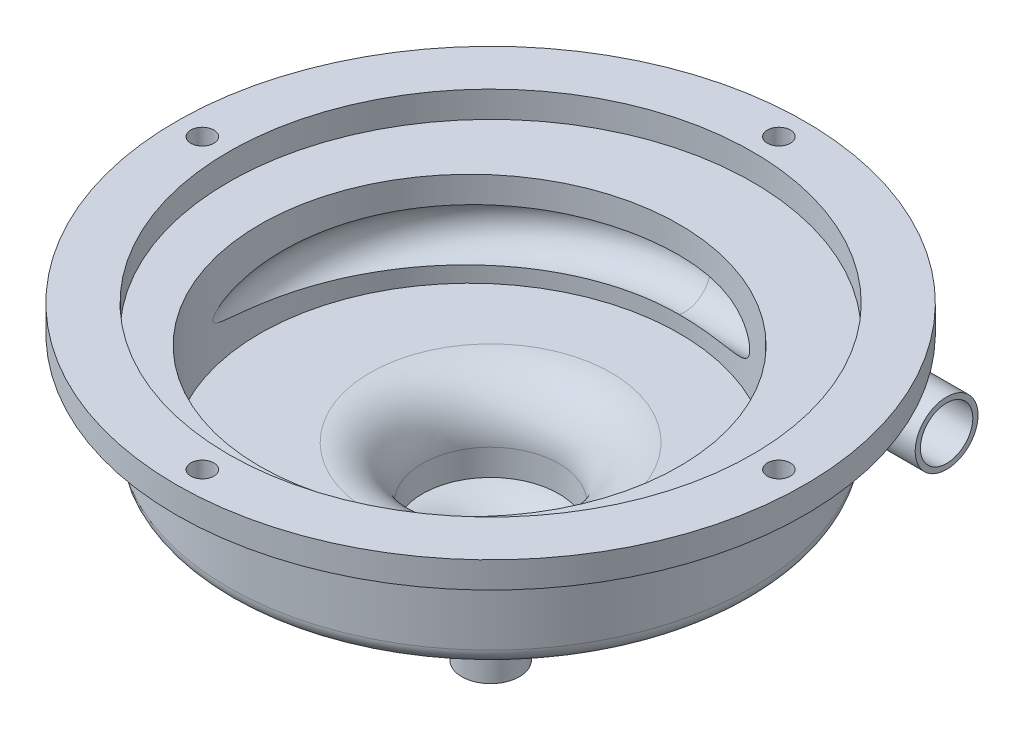
from build123d import *

# Parameters (mm, degrees)
SKETCH1_R                = 50
SKETCH1_R_2              = 40
BOSS_EXTRUDE1_DEPTH      = 20
BOSS_EXTRUDE2_DEPTH      = 2
BOSS_EXTRUDE2_DEPTH_BACK = 4
SKETCH2_R                = 40
SKETCH3_R                = 60
SKETCH3_R_2              = 50
SKETCH3_R_3              = 2.2
SKETCH3_R_4              = 2.2000000000012125
SKETCH3_R_5              = 2.200000000003338
SKETCH3_R_6              = 2.200000000002496
BOSS_EXTRUDE3_DEPTH      = 5
SKETCH4_R                = 5.999999999999995
SKETCH4_R_2              = 4.750000000000005
SKETCH7_R                = 4.9999999999999964
SKETCH9_R                = 15
BOSS_EXTRUDE5_DEPTH      = 15
SKETCH10_R               = 5.5
BOSS_EXTRUDE6_DEPTH      = 15
SKETCH11_R               = 4.5
CUT_EXTRUDE1_DEPTH       = 104.34892355511015
SKETCH12_R               = 13
CUT_EXTRUDE2_DEPTH       = 15
FILLET1_R                = 10
FILLET2_R                = 3


with BuildPart() as part:
    # Sketch1 → Boss-Extrude1 (new body)
    with BuildSketch(Plane(origin=(0, 0, 0), x_dir=(1, 0, 0), z_dir=(0, 1, 0))):
        with Locations(Location((0, 0, 0), (0, 0, 270))):
            Circle(SKETCH1_R)
        with Locations(Location((0, -4, 0), (0, 0, 270))):
            Circle(SKETCH1_R_2, mode=Mode.SUBTRACT)
    extrude(amount=BOSS_EXTRUDE1_DEPTH)

    # Sketch2 → Boss-Extrude2 (add, two sides: drawn at the far end of the back side and taken through both)
    with BuildSketch(Plane(origin=(0, 0, 0), x_dir=(1, 0, 0), z_dir=(0, 1, 0)).offset(-BOSS_EXTRUDE2_DEPTH_BACK)):
        with Locations(Location((0, -4, 0), (0, 0, 270))):
            Circle(SKETCH2_R)
    extrude(amount=BOSS_EXTRUDE2_DEPTH + BOSS_EXTRUDE2_DEPTH_BACK)

    # Sweep1: sweep along a path in Sketch5
    with BuildLine(Plane(origin=(0, 0, 0), x_dir=(1, 0, 0), z_dir=(0, 1, 0))) as sweep1_path:
        Line((50, 37), (19.856529596382096, 37))
    # Sketch4 → Sweep1 (sweep)
    with BuildSketch(Plane(origin=(50, 0, 0), x_dir=(0, 0, -1), z_dir=(1, 0, 0))):
        with Locations((37, 10)):
            Circle(SKETCH4_R)
        with Locations((37, 10)):
            Circle(SKETCH4_R_2, mode=Mode.SUBTRACT)
    sweep(path=sweep1_path.line)

    # Cut-Sweep4: sweep along a path in Sketch6
    with BuildLine(Plane(origin=(0, 0, 0), x_dir=(1, 0, 0), z_dir=(0, 1, 0))) as cut_sweep4_path:
        Line((50, 41), (0, 41))
        ThreePointArc((0, 41), (-39.04316241903396, 11.041127779829239), (-20.210228030153765, -34.42559784108742))
    # Sketch7 → Cut-Sweep4 (sweep, cut)
    with BuildSketch(Plane(origin=(50, 0, 0), x_dir=(0, 0, -1), z_dir=(1, 0, 0))):
        with Locations((37, 10)):
            Circle(SKETCH7_R)
    sweep(path=cut_sweep4_path.line, mode=Mode.SUBTRACT)

    # Sketch9 → Boss-Extrude5 (add)
    with BuildSketch(Plane.XZ.offset(4)):
        with Locations(Location((0, 0, 0), (0, 0, 270))):
            Circle(SKETCH9_R)
    extrude(amount=BOSS_EXTRUDE5_DEPTH)

    # Sketch10 → Boss-Extrude6 (add)
    with BuildSketch(Plane.XZ.offset(19)):
        with Locations(Location((0, 0, 0), (0, 0, 270))):
            Circle(SKETCH10_R)
    extrude(amount=BOSS_EXTRUDE6_DEPTH)

    # Sketch11 → Cut-Extrude1 (cut, through all)
    with BuildSketch(Plane.XZ.offset(34)):
        with Locations(Location((0, 0, 0), (0, 0, 270))):
            Circle(SKETCH11_R)
    extrude(amount=-CUT_EXTRUDE1_DEPTH, mode=Mode.SUBTRACT)

    # Sketch12 → Cut-Extrude2 (cut)
    with BuildSketch(Plane(origin=(0, 2, 0), x_dir=(1, 0, 0), z_dir=(0, 1, 0))):
        with Locations(Location((0, 0, 0), (0, 0, 270))):
            Circle(SKETCH12_R)
    extrude(amount=-CUT_EXTRUDE2_DEPTH, mode=Mode.SUBTRACT)

    # Fillet1
    # the kernel refuses this fillet: 10 mm, written as the material it takes off along each edge
    with BuildSketch(Plane(origin=(0, 2, 0), x_dir=(-1.8e-16, 0, 1), z_dir=(-1, 0, -1.8e-16))) as fillet1_piece_1:
        with BuildLine():
            CenterArc((13 + FILLET1_R, -FILLET1_R), FILLET1_R, 90, 90)
            Line((13, -FILLET1_R), (13 - FILLET1_R * 0.02, -FILLET1_R))
            Line((13 - FILLET1_R * 0.02, -FILLET1_R), (13 - FILLET1_R * 0.02, FILLET1_R * 0.02))
            Line((13 - FILLET1_R * 0.02, FILLET1_R * 0.02), (13 + FILLET1_R, FILLET1_R * 0.02))
            Line((13 + FILLET1_R, FILLET1_R * 0.02), (13 + FILLET1_R, 0))
        make_face()
    revolve(axis=Axis((0, 2, 0), (0, 1, 0)), mode=Mode.SUBTRACT)
    with BuildSketch(Plane(origin=(0, -13, 0), x_dir=(-1.8e-16, 0, -1), z_dir=(-1, 0, 1.8e-16))) as fillet1_piece_2:
        with BuildLine():
            CenterArc((14.5, 9.886859966642827), FILLET1_R, 180, 81.3730734413216)
            Line((4.5, 9.886859966642827), (4.3, 9.886859966642827))
            Line((4.3, 9.886859966642827), (4.3, 0))
            Line((4.3, 0), (4.5, -0.1999999999999993))
            ThreePointArc((4.5, -0.1999999999999993), (8.750000000000018, -0.1999999999999993), (12.970000000000036, -0.19773719933262512))
            Line((12.970000000000036, -0.19773719933262512), (13.000000000000036, 2.2737e-13))
        make_face()
    revolve(axis=Axis((0, -13, 0), (0, -1, 0)), mode=Mode.SUBTRACT)

    # Fillet2
    fillet2_edges = [part.edges().sort_by_distance(p)[0] for p in [
        (1.225e-14, -4, -36),
        (1.531e-14, 0, -50),
        (1.125e-14, -19, 15),
    ]]
    fillet(fillet2_edges, radius=FILLET2_R)


with BuildPart() as body_2:
    # Sketch3 → Boss-Extrude3 (new body)
    with BuildSketch(Plane(origin=(0, 20, 0), x_dir=(1, 0, 0), z_dir=(0, 1, 0))):
        with Locations(Location((0, 0, 0), (0, 0, 270))):
            Circle(SKETCH3_R)
        with Locations(Location((0, 0, 0), (0, 0, 270))):
            Circle(SKETCH3_R_2, mode=Mode.SUBTRACT)
        with Locations(Location((0, 55, 0), (0, 0, 270))):
            Circle(SKETCH3_R_3, mode=Mode.SUBTRACT)
        with Locations(Location((55.000000000001556, 1.55309e-12, 0), (0, 0, 270))):
            Circle(SKETCH3_R_4, mode=Mode.SUBTRACT)
        with Locations(Location((3.10618e-12, -55, 0), (0, 0, 270))):
            Circle(SKETCH3_R_5, mode=Mode.SUBTRACT)
        with Locations(Location((-54.99999999999845, -1.55983e-12, 0), (0, 0, 270))):
            Circle(SKETCH3_R_6, mode=Mode.SUBTRACT)
    extrude(amount=BOSS_EXTRUDE3_DEPTH)


solid = Compound([part.part, body_2.part])
